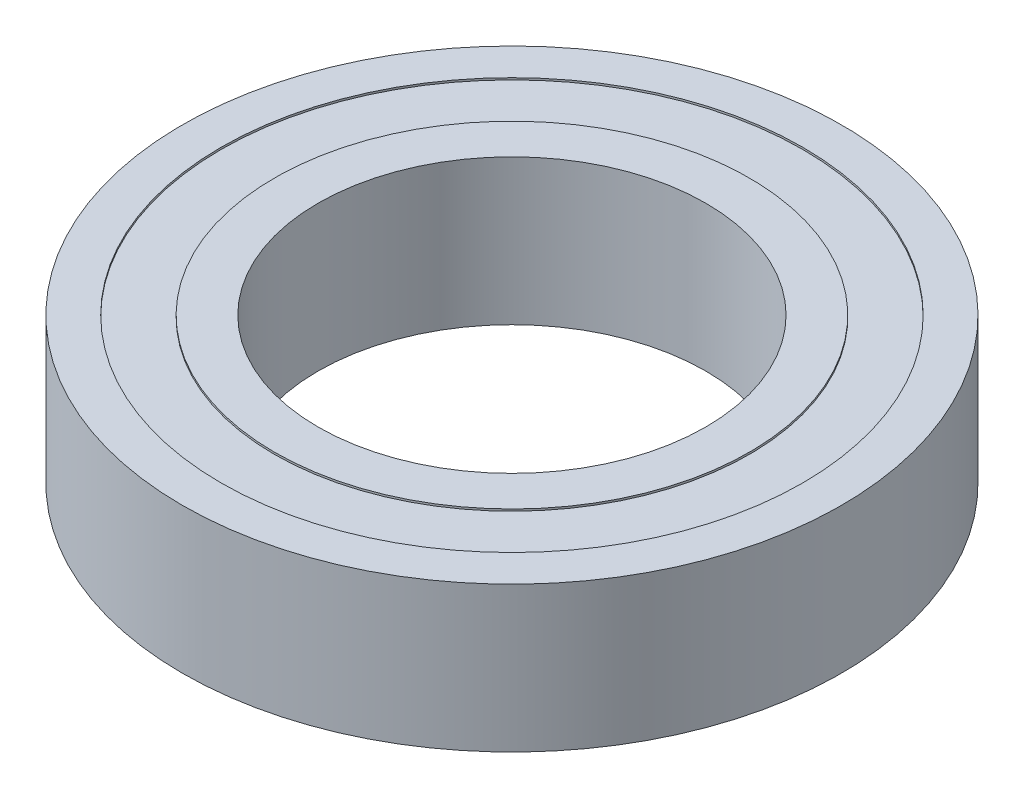
from build123d import *

# Parameters (mm, degrees)
ESQUISSE1_R             = 34
ESQUISSE1_R_2           = 20
BOSS_EXTRU_1_DEPTH      = 15
ESQUISSE2_R             = 30
ESQUISSE2_R_2           = 24.5
ENL_V_MAT_EXTRU_1_DEPTH = 0.2
ENL_V_START             = -0.2
ESQUISSE3_R             = 30
ESQUISSE3_R_2           = 24.5
ENL_V_MAT_EXTRU_2_DEPTH = 0.2


with BuildPart() as part:
    # Esquisse1 → Boss.-Extru.1 (new body)
    with BuildSketch(Plane(origin=(0, 0, 0), x_dir=(1, 0, 0), z_dir=(0, 1, 0))):
        Circle(ESQUISSE1_R)
        Circle(ESQUISSE1_R_2, mode=Mode.SUBTRACT)
    extrude(amount=BOSS_EXTRU_1_DEPTH)

    # Esquisse2 → Enlèv. mat.-Extru.1 (cut)
    with BuildSketch(Plane(origin=(0, 15, 0), x_dir=(1, 0, 0), z_dir=(0, 1, 0))):
        Circle(ESQUISSE2_R)
        Circle(ESQUISSE2_R_2, mode=Mode.SUBTRACT)
    extrude(amount=-ENL_V_MAT_EXTRU_1_DEPTH, mode=Mode.SUBTRACT)

    # Esquisse3 → Enlèv. mat.-Extru.2 (cut)
    with BuildSketch(Plane.XZ.offset(ENL_V_START)):
        Circle(ESQUISSE3_R)
        Circle(ESQUISSE3_R_2, mode=Mode.SUBTRACT)
    extrude(amount=ENL_V_MAT_EXTRU_2_DEPTH, mode=Mode.SUBTRACT)


solid = part.part
